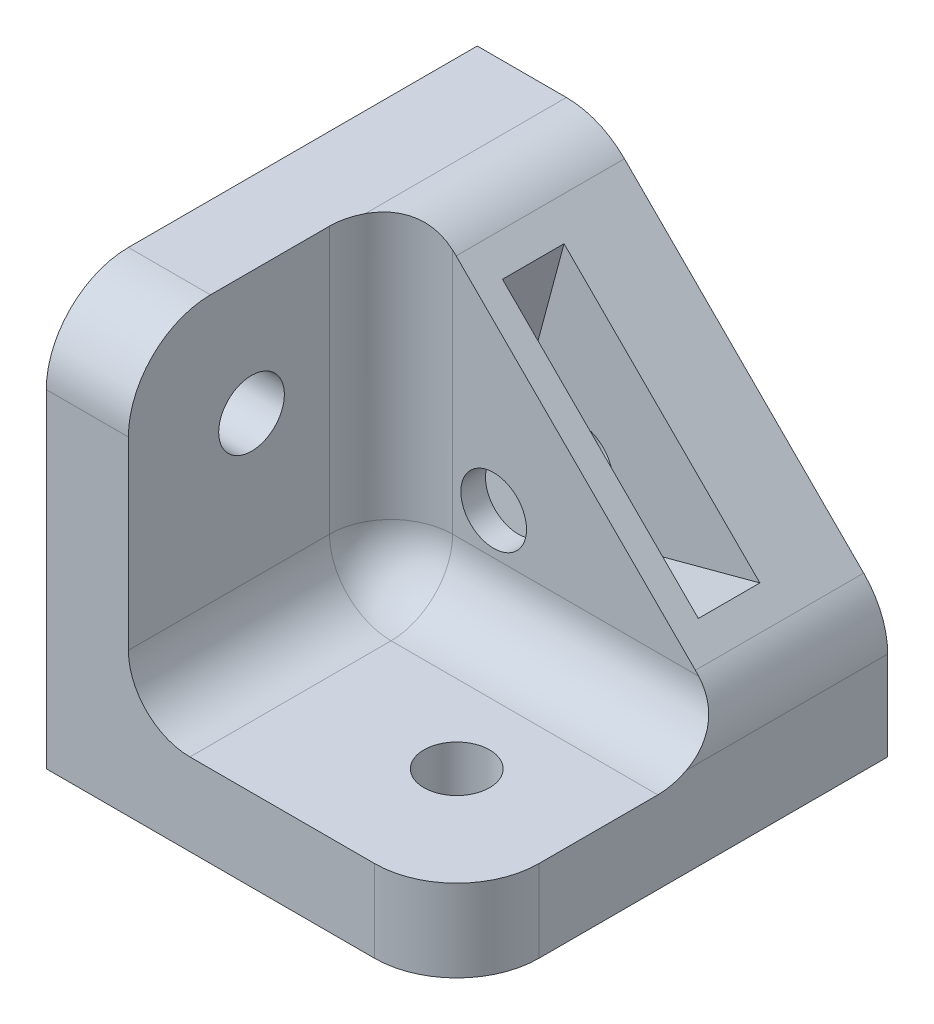
from build123d import *

# Parameters (mm, degrees)
BOSS_EXTRUDE4_DEPTH                  = 8.2
BOSS_EXTRUDE5_DEPTH                  = 21
F_3_2_3_2_DIAMETER_HOLE1_D           = 3.2
F_3_2_3_2_DIAMETER_HOLE1_ON_FACE_2_D = 3.2
F_3_2_3_2_DIAMETER_HOLE1_ON_FACE_3_D = 3.2
FILLET1_R                            = 3
FILLET2_R                            = 4
CUT_EXTRUDE2_START                   = -4
CUT_EXTRUDE2_DEPTH                   = 3


with BuildPart() as part:
    # Sketch4 → Boss-Extrude4 (new body)
    with BuildSketch(Plane.XY):
        Polygon((0, 20), (0, 0), (20, 0), (20, 6), (6, 20), align=None)
    extrude(amount=BOSS_EXTRUDE4_DEPTH)

    # Sketch4<4> → Boss-Extrude5 (add)
    with BuildSketch(Plane.XY):
        Polygon((0, 20), (0, 0), (20, 0), (20, 4), (4, 4), (4, 20), align=None)
    extrude(amount=BOSS_EXTRUDE5_DEPTH)

    # Ø3.2 (3.2) Diameter Hole1 (through all)
    with Locations(Plane(origin=(14, 0, 15), x_dir=(0, 0, -1), z_dir=(0, -1, 0))):
        with Locations((0, 0)):
            Hole(F_3_2_3_2_DIAMETER_HOLE1_D / 2)

    # Ø3.2 (3.2) Diameter Hole1 on face 2 (through all)
    with Locations(Plane(origin=(0, 14, 15), x_dir=(0, 0, -1), z_dir=(-1, 0, 0))):
        with Locations((0, 0)):
            Hole(F_3_2_3_2_DIAMETER_HOLE1_ON_FACE_2_D / 2)

    # Ø3.2 (3.2) Diameter Hole1 on face 3 (through all)
    with Locations(Plane(origin=(9, 9, 0), x_dir=(-1, 0, 0), z_dir=(0, 0, -1))):
        with Locations((0, 0)):
            Hole(F_3_2_3_2_DIAMETER_HOLE1_ON_FACE_3_D / 2)

    # Fillet1
    fillet1_edges = [part.edges().sort_by_distance(p)[0] for p in [
        (12, 4, 8.2),
        (4, 4, 14.6),
        (4, 12, 8.2),
    ]]
    fillet(fillet1_edges, radius=FILLET1_R)

    # Fillet2
    fillet2_edges = [part.edges().sort_by_distance(p)[0] for p in [
        (6, 20, 4.185786438),
        (20, 6, 4.185786438),
        (20, 2, 21),
        (2, 20, 21),
    ]]
    fillet(fillet2_edges, radius=FILLET2_R)

    # Sketch7 → Cut-Extrude2 (cut)
    with BuildSketch(Plane(origin=(0, 0, 0), x_dir=(-1, 0, 0), z_dir=(0, 0, -1)).offset(CUT_EXTRUDE2_START)):
        Polygon((-8.228417185, 17.771582815), (-5.641242789, 8.116116524), (-8.116116524, 5.641242789), (-17.771582815, 8.228417185), align=None)
    extrude(amount=-CUT_EXTRUDE2_DEPTH, mode=Mode.SUBTRACT)


solid = part.part
